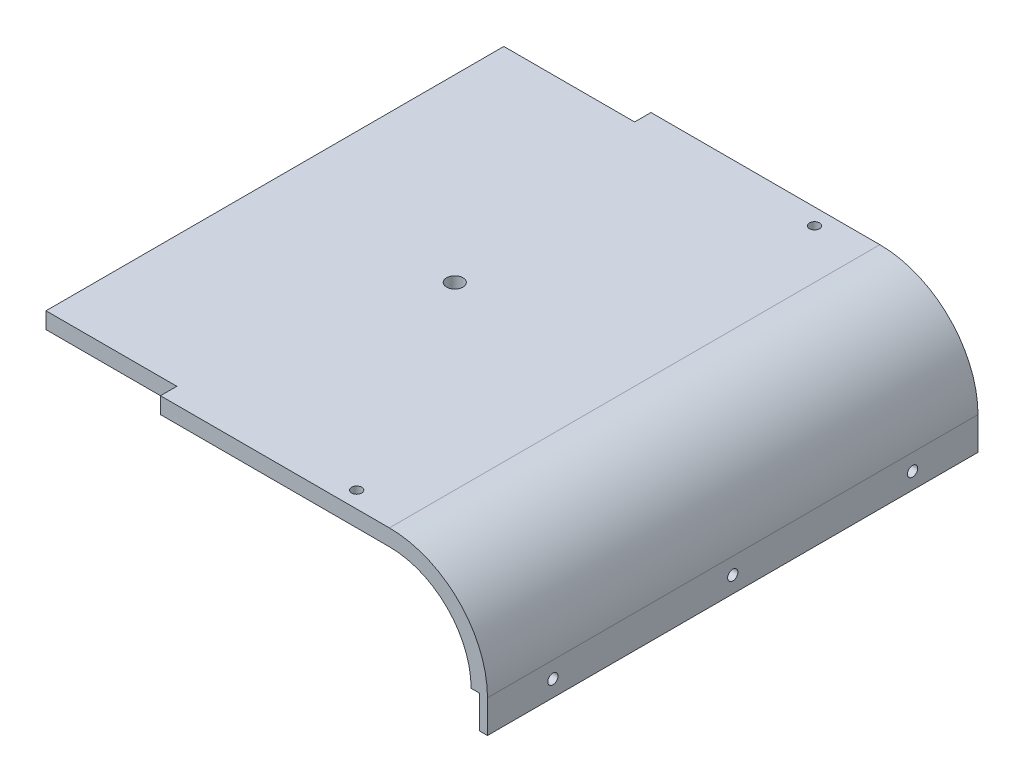
from build123d import *

# Parameters (mm, degrees)
BOSS_EXTRUDE1_DEPTH      = 190.5
BOSS_EXTRUDE1_DEPTH_BACK = 190.5
SKETCH2_W                = 6.35
SKETCH2_H                = 381
BOSS_EXTRUDE2_DEPTH      = 25.4
SKETCH3_R                = 3.96875
CUT_EXTRUDE1_DEPTH       = 25.4
SKETCH4_R                = 6.35
CUT_EXTRUDE2_DEPTH       = 17.78
SKETCH5_R                = 3.937
CUT_EXTRUDE3_DEPTH       = 306.328708116


with BuildPart() as part:
    # Sketch1 → Boss-Extrude1 (new, two sides: drawn at the far end of the back side and taken through both)
    with BuildSketch(Plane.XY.offset(-BOSS_EXTRUDE1_DEPTH_BACK)):
        with BuildLine():
            Line((-139.7, 0), (139.7, 0))
            ThreePointArc((139.7, 0), (193.581536726, -22.318463274), (215.9, -76.2))
            Line((215.9, -76.2), (203.2, -76.2))
            ThreePointArc((203.2, -76.2), (184.601280605, -31.298719395), (139.7, -12.7))
            Line((139.7, -12.7), (-139.7, -12.7))
            Line((-139.7, -12.7), (-139.7, 0))
        make_face()
    extrude(amount=BOSS_EXTRUDE1_DEPTH + BOSS_EXTRUDE1_DEPTH_BACK)

    # Sketch2 → Boss-Extrude2 (add)
    with BuildSketch(Plane.XZ.offset(76.2)):
        with Locations((212.725, 0)):
            Rectangle(SKETCH2_W, SKETCH2_H)
    extrude(amount=BOSS_EXTRUDE2_DEPTH)

    # Sketch3 → Cut-Extrude1 (cut)
    with BuildSketch(Plane(origin=(215.9, 0, 0), x_dir=(0, 0, -1), z_dir=(1, 0, 0))):
        with Locations((-139.7, -88.9)):
            Circle(SKETCH3_R)
        with Locations((0, -88.9)):
            Circle(SKETCH3_R)
        with Locations((139.7, -88.9)):
            Circle(SKETCH3_R)
    extrude(amount=-CUT_EXTRUDE1_DEPTH, mode=Mode.SUBTRACT)

    # Sketch4 → Cut-Extrude2 (cut)
    with BuildSketch(Plane(origin=(0, 0, 0), x_dir=(1, 0, 0), z_dir=(0, 1, 0))):
        Circle(SKETCH4_R)
    extrude(amount=-CUT_EXTRUDE2_DEPTH, mode=Mode.SUBTRACT)

    # Sketch5 → Cut-Extrude3 (cut, through all)
    with BuildSketch(Plane(origin=(0, 0, 0), x_dir=(1, 0, 0), z_dir=(0, 1, 0))):
        with Locations((101.6, -177.8)):
            Circle(SKETCH5_R)
        with Locations((101.6, 177.8)):
            Circle(SKETCH5_R)
        Polygon((-101.6, -177.8), (-139.7, -177.8), (-139.7, -190.5), (-38.1, -190.5), (-38.1, -177.8), align=None)
        Polygon((-38.1, 190.5), (-38.1, 177.8), (-101.6, 177.8), (-139.7, 177.8), (-139.7, 190.5), align=None)
    extrude(amount=-CUT_EXTRUDE3_DEPTH, mode=Mode.SUBTRACT)


solid = part.part
